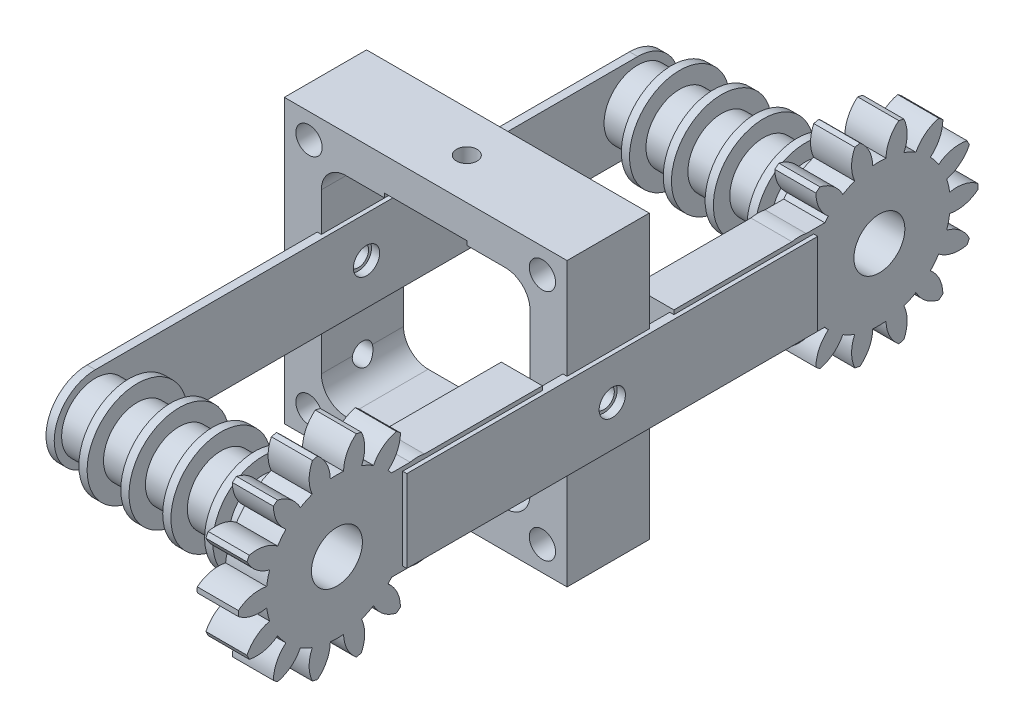
from build123d import *
from build123d.topology import SkipClean

# Parameters (mm, degrees)
BASPROSKE_W              = 5
BASPROSKE_H              = 12
TOOTHCUT_DEPTH           = 18.691806013
TEETHCUTS_COUNT          = 14
TEETHCUTS_ANGLE          = 334.285714286
BORSKE_R                 = 3.1
BORE_DEPTH               = 50.0000508
SKETCH_2_W               = 20
SKETCH_2_H               = 11
EXTRUDE_1_DEPTH          = 5
SKETCH_3_W               = 17
SKETCH_3_H               = 10
CUT_EXTRUDE_1_DEPTH      = 0.5
SKETCH_5_W               = 10
SKETCH_5_H               = 10
SKETCH_5_W_2             = 8
SKETCH_5_H_2             = 8
EXTRUDE_2_DEPTH          = 25
SKETCH_12_W              = 9
SKETCH_12_H              = 10
CUT_EXTRUDE_4_DEPTH      = 49.720495562
CUT_EXTRUDE_2_DEPTH      = 36.463878635
CUT_EXTRUDE_2_DEPTH_BACK = 36.463878635
SKETCH_4_R               = 1.25
SKETCH_7_R               = 4.1
SKETCH_7_R_2             = 3.1
EXTRUDE_3_DEPTH          = 4
PATTERN_LINEAR_1_COUNT   = 5
PATTERN_LINEAR_1_PITCH   = 5.1
SKETCH_14_R              = 3.1
EXTRUDE_5_DEPTH          = 1
SKETCH_15_W              = 34.4
SKETCH_15_H              = 34.4
SKETCH_15_R              = 1.6
EXTRUDE_6_DEPTH          = 5
SKETCH_17_R              = 6.1
SKETCH_17_R_2            = 3.1
EXTRUDE_8_DEPTH          = 1
PATTERN_LINEAR_3_COUNT   = 4
PATTERN_LINEAR_3_PITCH   = 5.1
PATTERN_LINEAR_2_COUNT   = 2
PATTERN_LINEAR_2_PITCH   = 100
MOVE_BODY_2_ANGLE        = 180
MOVE_BODY_2_2_ANGLE      = 180
MOVE_BODY_2_3_ANGLE      = 180
MOVE_BODY_2_4_ANGLE      = 180
MOVE_BODY_2_5_ANGLE      = 180
MOVE_BODY_2_6_ANGLE      = 180
MOVE_BODY_2_7_ANGLE      = 180
MOVE_BODY_2_8_ANGLE      = 180
MOVE_BODY_2_9_ANGLE      = 180
MOVE_BODY_2_10_ANGLE     = 180
MOVE_BODY_2_11_ANGLE     = 180
MOVE_BODY_2_12_ANGLE     = 180
MOVE_BODY_2_13_ANGLE     = 180
CUT_EXTRUDE_5_DEPTH      = 57.59196056
CUT_EXTRUDE_5_DEPTH_BACK = 57.59196056
SKETCH_16_W              = 10
SKETCH_16_H              = 1
SKETCH_16_W_2            = 1
SKETCH_16_H_2            = 10
EXTRUDE_START            = -5
EXTRUDE_7_OUTLINE_W      = 1
EXTRUDE_7_OUTLINE_H      = 10
EXTRUDE_7_DEPTH          = 5
EXTRUDE_7_2_OUTLINE_W    = 1
EXTRUDE_7_2_OUTLINE_H    = 10
EXTRUDE_7_2_DEPTH        = 5
EXTRUDE_7_3_OUTLINE_W    = 10
EXTRUDE_7_3_OUTLINE_H    = 1
EXTRUDE_7_3_DEPTH        = 5
EXTRUDE_7_4_OUTLINE_W    = 10
EXTRUDE_7_4_OUTLINE_H    = 1
EXTRUDE_7_4_DEPTH        = 5
SKETCH_21_R              = 1.25
CUT_EXTRUDE_6_DEPTH      = 88.265686269
SKETCH_22_R              = 1.25
CUT_EXTRUDE_7_DEPTH      = 91.367969989
SKETCH_23_R              = 1.6
CUT_EXTRUDE_8_DEPTH      = 88.265686269
SKETCH_24_R              = 1.6
CUT_EXTRUDE_9_DEPTH      = 91.367969989
SKETCH_26_R              = 1.25
CUT_EXTRUDE_10_DEPTH     = 10


with BuildPart() as part:
    # BasProSke → Base-Revolve (revolve)
    with BuildSketch(Plane(origin=(0, 0, 0), x_dir=(1, 0, 0), z_dir=(0, 1, 0)), mode=Mode.PRIVATE) as base_revolve_sk:
        with Locations((2.5, 6)):
            Rectangle(BASPROSKE_W, BASPROSKE_H)
    revolve(base_revolve_sk.sketch.rotate(Axis((-10, 0, 0), (1, 0, 0)), 180), axis=Axis((-10, 0, 0), (1, 0, 0)))

    # TooCutSke → ToothCut (cut, through all)
    with BuildSketch(Plane(origin=(0, 0, 0), x_dir=(0, 0, -1), z_dir=(1, 0, 0))):
        with BuildLine():
            ThreePointArc((0.804845511, 8.586361261), (0, 8.624), (-0.804845511, 8.586361261))
            ThreePointArc((-0.804845511, 8.586361261), (-1.237812142, 10.362618414), (-2.384428228, 11.78663426))
            ThreePointArc((-2.384428228, 11.78663426), (0, 12.0254), (2.384428228, 11.78663426))
            ThreePointArc((2.384428228, 11.78663426), (1.237812142, 10.362618414), (0.804845511, 8.586361261))
        make_face()
    toothcut = extrude(amount=TOOTHCUT_DEPTH, mode=Mode.SUBTRACT)

    # TeethCuts: ToothCut ×14 about axis
    teethcuts_axis = Axis((-10, 0, 0), (1, 0, 0))
    for i in range(1, TEETHCUTS_COUNT):
        add(toothcut.rotate(teethcuts_axis, i * TEETHCUTS_ANGLE / (TEETHCUTS_COUNT - 1)), mode=Mode.SUBTRACT)

    # BorSke → Bore (cut, symmetric)
    with BuildSketch(Plane(origin=(0, 0, 0), x_dir=(0, 0, -1), z_dir=(1, 0, 0))):
        with Locations(Location((0, 0, 0), (0, 0, 180))):
            Circle(BORSKE_R)
    extrude(amount=BORE_DEPTH, both=True, mode=Mode.SUBTRACT)

    # ｽｹｯﾁ2 → ﾎﾞｽ - 押し出し1 (add)
    with BuildSketch(Plane(origin=(5, 0, 0), x_dir=(0, 0, -1), z_dir=(1, 0, 0))):
        with Locations((15, 0)):
            Rectangle(SKETCH_2_W, SKETCH_2_H)
    extrude(amount=-EXTRUDE_1_DEPTH)

    # ｽｹｯﾁ3 → ｶｯﾄ - 押し出し1 (cut)
    with BuildSketch(Plane(origin=(5, 0, 0), x_dir=(0, 0, -1), z_dir=(1, 0, 0))):
        with Locations((16.5, 0)):
            Rectangle(SKETCH_3_W, SKETCH_3_H)
    extrude(amount=-CUT_EXTRUDE_1_DEPTH, mode=Mode.SUBTRACT)

    # ｽｹｯﾁ4 → ｶｯﾄ - 押し出し2 (cut, two sides: drawn at the far end of the back side and taken through both)
    with BuildSketch(Plane.ZY.offset(-CUT_EXTRUDE_2_DEPTH_BACK)):
        with Locations(Location((-21, 0, 0), (0, 0, 180))):
            Circle(SKETCH_4_R)
        with Locations(Location((-13, 0, 0), (0, 0, 180))):
            Circle(SKETCH_4_R)
    extrude(amount=CUT_EXTRUDE_2_DEPTH + CUT_EXTRUDE_2_DEPTH_BACK, mode=Mode.SUBTRACT)


with BuildPart() as body_2:
    # ｽｹｯﾁ5 → ﾎﾞｽ - 押し出し2 (new body)
    with BuildSketch(Plane(origin=(0, 0, -8), x_dir=(-1, 0, 0), z_dir=(0, 0, -1))):
        with Locations((-9.5, 0)):
            Rectangle(SKETCH_5_W, SKETCH_5_H)
        with Locations((-9.5, 0)):
            Rectangle(SKETCH_5_W_2, SKETCH_5_H_2, mode=Mode.SUBTRACT)
    extrude(amount=EXTRUDE_2_DEPTH)

    # ｽｹｯﾁ12 → ｶｯﾄ - 押し出し4 (cut, through all)
    with BuildSketch(Plane(origin=(0, 0, -33), x_dir=(-1, 0, 0), z_dir=(0, 0, -1))):
        with Locations((-10, 0)):
            Rectangle(SKETCH_12_W, SKETCH_12_H)
    extrude(amount=-CUT_EXTRUDE_4_DEPTH, mode=Mode.SUBTRACT)


with BuildPart() as body_3:
    # ｽｹｯﾁ7 → ﾎﾞｽ - 押し出し3 (new body)
    with BuildSketch(Plane.ZY):
        Circle(SKETCH_7_R)
        Circle(SKETCH_7_R_2, mode=Mode.SUBTRACT)
    extrude(amount=EXTRUDE_3_DEPTH)


with BuildPart() as pattern_linear_1_1:
    # 直線ﾊﾟﾀｰﾝ1: pattern copy
    add(body_3.part.moved(Location(Vector(-1, 0, 0) * (1 * PATTERN_LINEAR_1_PITCH))))


with BuildPart() as pattern_linear_1_2:
    # 直線ﾊﾟﾀｰﾝ1: pattern copy
    add(body_3.part.moved(Location(Vector(-1, 0, 0) * (2 * PATTERN_LINEAR_1_PITCH))))


with BuildPart() as pattern_linear_1_3:
    # 直線ﾊﾟﾀｰﾝ1: pattern copy
    add(body_3.part.moved(Location(Vector(-1, 0, 0) * (3 * PATTERN_LINEAR_1_PITCH))))


with BuildPart() as pattern_linear_1_4:
    # 直線ﾊﾟﾀｰﾝ1: pattern copy
    add(body_3.part.moved(Location(Vector(-1, 0, 0) * (4 * PATTERN_LINEAR_1_PITCH))))


with BuildPart() as body_8:
    # ｽｹｯﾁ14 → ﾎﾞｽ - 押し出し5 (new body)
    with BuildSketch(Plane.ZY.offset(24.4)):
        with BuildLine():
            Line((-33, 5), (0, 5))
            ThreePointArc((0, 5), (5, 0), (0, -5))
            Line((0, -5), (-33, -5))
            Line((-33, -5), (-33, 5))
        make_face()
        Circle(SKETCH_14_R, mode=Mode.SUBTRACT)
    extrude(amount=EXTRUDE_5_DEPTH)


with BuildPart() as body_9:
    # ｽｹｯﾁ15 → ﾎﾞｽ - 押し出し6 (new body)
    with BuildSketch(Plane(origin=(0, 0, -33), x_dir=(-1, 0, 0), z_dir=(0, 0, -1))):
        with Locations((12.2, 0)):
            Rectangle(SKETCH_15_W, SKETCH_15_H)
        with Locations(Location((26.4, 14.2, 0), (0, 0, 90))):
            Circle(SKETCH_15_R, mode=Mode.SUBTRACT)
        with Locations(Location((26.4, -14.2, 0), (0, 0, 90))):
            Circle(SKETCH_15_R, mode=Mode.SUBTRACT)
        with Locations(Location((-2, -14.2, 0), (0, 0, 90))):
            Circle(SKETCH_15_R, mode=Mode.SUBTRACT)
        with Locations(Location((-2, 14.2, 0), (0, 0, 90))):
            Circle(SKETCH_15_R, mode=Mode.SUBTRACT)
        with BuildLine():
            Line((21.9, -12.7), (2.5, -12.7))
            ThreePointArc((2.5, -12.7), (0.378679656, -11.821320344), (-0.5, -9.7))
            Line((-0.5, -9.7), (-0.5, 9.7))
            ThreePointArc((-0.5, 9.7), (0.378679656, 11.821320344), (2.5, 12.7))
            Line((2.5, 12.7), (21.9, 12.7))
            ThreePointArc((21.9, 12.7), (24.021320344, 11.821320344), (24.9, 9.7))
            Line((24.9, 9.7), (24.9, -9.7))
            ThreePointArc((24.9, -9.7), (24.021320344, -11.821320344), (21.9, -12.7))
        make_face(mode=Mode.SUBTRACT)
    extrude(amount=-EXTRUDE_6_DEPTH)


with BuildPart() as body_10:
    # ｽｹｯﾁ17 → ﾎﾞｽ - 押し出し8 (new body)
    with BuildSketch(Plane.ZY.offset(4)):
        Circle(SKETCH_17_R)
        Circle(SKETCH_17_R_2, mode=Mode.SUBTRACT)
    extrude(amount=EXTRUDE_8_DEPTH)


with BuildPart() as pattern_linear_3_1:
    # 直線ﾊﾟﾀｰﾝ3: pattern copy
    add(body_10.part.moved(Location(Vector(-1, 0, 0) * (1 * PATTERN_LINEAR_3_PITCH))))


with BuildPart() as pattern_linear_3_2:
    # 直線ﾊﾟﾀｰﾝ3: pattern copy
    add(body_10.part.moved(Location(Vector(-1, 0, 0) * (2 * PATTERN_LINEAR_3_PITCH))))


with BuildPart() as pattern_linear_3_3:
    # 直線ﾊﾟﾀｰﾝ3: pattern copy
    add(body_10.part.moved(Location(Vector(-1, 0, 0) * (3 * PATTERN_LINEAR_3_PITCH))))


with BuildPart() as pattern_linear_2_1:
    # 直線ﾊﾟﾀｰﾝ2: pattern copy
    add(body_10.part.moved(Location(Vector(0, 0, -1) * (1 * PATTERN_LINEAR_2_PITCH))))


with BuildPart() as pattern_linear_2_2:
    # 直線ﾊﾟﾀｰﾝ2: pattern copy
    add(pattern_linear_3_1.part.moved(Location(Vector(0, 0, -1) * (1 * PATTERN_LINEAR_2_PITCH))))


with BuildPart() as pattern_linear_2_3:
    # 直線ﾊﾟﾀｰﾝ2: pattern copy
    add(pattern_linear_3_2.part.moved(Location(Vector(0, 0, -1) * (1 * PATTERN_LINEAR_2_PITCH))))


with BuildPart() as pattern_linear_2_4:
    # 直線ﾊﾟﾀｰﾝ2: pattern copy
    add(pattern_linear_3_3.part.moved(Location(Vector(0, 0, -1) * (1 * PATTERN_LINEAR_2_PITCH))))


with BuildPart() as pattern_linear_2_5:
    # 直線ﾊﾟﾀｰﾝ2: pattern copy
    add(body_3.part.moved(Location(Vector(0, 0, -1) * (1 * PATTERN_LINEAR_2_PITCH))))


with BuildPart() as pattern_linear_2_6:
    # 直線ﾊﾟﾀｰﾝ2: pattern copy
    add(pattern_linear_1_1.part.moved(Location(Vector(0, 0, -1) * (1 * PATTERN_LINEAR_2_PITCH))))


with BuildPart() as pattern_linear_2_7:
    # 直線ﾊﾟﾀｰﾝ2: pattern copy
    add(body_9.part.moved(Location(Vector(0, 0, -1) * (1 * PATTERN_LINEAR_2_PITCH))))


with BuildPart() as pattern_linear_2_8:
    # 直線ﾊﾟﾀｰﾝ2: pattern copy
    add(pattern_linear_1_2.part.moved(Location(Vector(0, 0, -1) * (1 * PATTERN_LINEAR_2_PITCH))))


with BuildPart() as pattern_linear_2_9:
    # 直線ﾊﾟﾀｰﾝ2: pattern copy
    add(pattern_linear_1_3.part.moved(Location(Vector(0, 0, -1) * (1 * PATTERN_LINEAR_2_PITCH))))


with BuildPart() as pattern_linear_2_10:
    # 直線ﾊﾟﾀｰﾝ2: pattern copy
    add(body_2.part.moved(Location(Vector(0, 0, -1) * (1 * PATTERN_LINEAR_2_PITCH))))


with BuildPart() as pattern_linear_2_11:
    # 直線ﾊﾟﾀｰﾝ2: pattern copy
    add(part.part.moved(Location(Vector(0, 0, -1) * (1 * PATTERN_LINEAR_2_PITCH))))


with BuildPart() as pattern_linear_2_12:
    # 直線ﾊﾟﾀｰﾝ2: pattern copy
    add(pattern_linear_1_4.part.moved(Location(Vector(0, 0, -1) * (1 * PATTERN_LINEAR_2_PITCH))))


with BuildPart() as pattern_linear_2_13:
    # 直線ﾊﾟﾀｰﾝ2: pattern copy
    add(body_8.part.moved(Location(Vector(0, 0, -1) * (1 * PATTERN_LINEAR_2_PITCH))))


with BuildPart() as pattern_linear_2_2_1:
    # Move Body 2: read off the stored shape, not the designer's step
    # Move Body 2: moved
    add(pattern_linear_2_2.part.moved(Location((12.2, 12.2, 166))).rotate(Axis((0, 0, 0), (0.7071067812, -0.7071067812, 0)), MOVE_BODY_2_ANGLE))


with BuildPart() as pattern_linear_2_12_1:
    # Move Body 2 2: moved
    add(pattern_linear_2_12.part.moved(Location((12.2, 12.2, 166))).rotate(Axis((0, 0, 0), (0.7071067812, -0.7071067812, 0)), MOVE_BODY_2_2_ANGLE))


with BuildPart() as pattern_linear_2_9_1:
    # Move Body 2 3: moved
    add(pattern_linear_2_9.part.moved(Location((12.2, 12.2, 166))).rotate(Axis((0, 0, 0), (0.7071067812, -0.7071067812, 0)), MOVE_BODY_2_3_ANGLE))


with BuildPart() as pattern_linear_2_11_1:
    # Move Body 2 4: moved
    add(pattern_linear_2_11.part.moved(Location((12.2, 12.2, 166))).rotate(Axis((0, 0, 0), (0.7071067812, -0.7071067812, 0)), MOVE_BODY_2_4_ANGLE))


with BuildPart() as pattern_linear_2_3_1:
    # Move Body 2 5: moved
    add(pattern_linear_2_3.part.moved(Location((12.2, 12.2, 166))).rotate(Axis((0, 0, 0), (0.7071067812, -0.7071067812, 0)), MOVE_BODY_2_5_ANGLE))


with BuildPart() as pattern_linear_2_4_1:
    # Move Body 2 6: moved
    add(pattern_linear_2_4.part.moved(Location((12.2, 12.2, 166))).rotate(Axis((0, 0, 0), (0.7071067812, -0.7071067812, 0)), MOVE_BODY_2_6_ANGLE))


with BuildPart() as pattern_linear_2_5_1:
    # Move Body 2 7: moved
    add(pattern_linear_2_5.part.moved(Location((12.2, 12.2, 166))).rotate(Axis((0, 0, 0), (0.7071067812, -0.7071067812, 0)), MOVE_BODY_2_7_ANGLE))


with BuildPart() as pattern_linear_2_8_1:
    # Move Body 2 8: moved
    add(pattern_linear_2_8.part.moved(Location((12.2, 12.2, 166))).rotate(Axis((0, 0, 0), (0.7071067812, -0.7071067812, 0)), MOVE_BODY_2_8_ANGLE))


with BuildPart() as pattern_linear_2_6_1:
    # Move Body 2 9: moved
    add(pattern_linear_2_6.part.moved(Location((12.2, 12.2, 166))).rotate(Axis((0, 0, 0), (0.7071067812, -0.7071067812, 0)), MOVE_BODY_2_9_ANGLE))


with BuildPart() as pattern_linear_2_1_1:
    # Move Body 2 10: moved
    add(pattern_linear_2_1.part.moved(Location((12.2, 12.2, 166))).rotate(Axis((0, 0, 0), (0.7071067812, -0.7071067812, 0)), MOVE_BODY_2_10_ANGLE))


with BuildPart() as pattern_linear_2_13_1:
    # Move Body 2 11: moved
    add(pattern_linear_2_13.part.moved(Location((12.2, 12.2, 166))).rotate(Axis((0, 0, 0), (0.7071067812, -0.7071067812, 0)), MOVE_BODY_2_11_ANGLE))

    # Extrude 7 3 outline → Extrude 7 3 (add)
    with BuildSketch(Plane.XY.offset(-33)):
        with Locations((-12.2, 12.7)):
            Rectangle(EXTRUDE_7_3_OUTLINE_W, EXTRUDE_7_3_OUTLINE_H)
    extrude(amount=EXTRUDE_7_3_DEPTH)


with BuildPart() as pattern_linear_2_10_1:
    # Move Body 2 12: moved
    add(pattern_linear_2_10.part.moved(Location((12.2, 12.2, 166))).rotate(Axis((0, 0, 0), (0.7071067812, -0.7071067812, 0)), MOVE_BODY_2_12_ANGLE))

    # Extrude 7 4 outline → Extrude 7 4 (add)
    with BuildSketch(Plane.XY.offset(-33)):
        with Locations((-12.2, -17.2)):
            Rectangle(EXTRUDE_7_4_OUTLINE_W, EXTRUDE_7_4_OUTLINE_H)
    extrude(amount=EXTRUDE_7_4_DEPTH)


with BuildPart() as pattern_linear_2_7_1:
    # Move Body 2 13: moved
    add(pattern_linear_2_7.part.moved(Location((12.2, 12.2, 166))).rotate(Axis((0, 0, 0), (0.7071067812, -0.7071067812, 0)), MOVE_BODY_2_13_ANGLE))


with BuildPart() as cut_extrude_5_tool:
    # ｽｹｯﾁ16 → ｶｯﾄ - 押し出し5 (new, two sides: drawn at the far end of the back side and taken through both)
    with BuildSketch(Plane.XY.offset(-33).offset(-CUT_EXTRUDE_5_DEPTH_BACK)):
        with Locations((-12.2, -17.2)):
            Rectangle(SKETCH_16_W, SKETCH_16_H)
        with Locations((5, 0)):
            Rectangle(SKETCH_16_W_2, SKETCH_16_H_2)
        with Locations((-12.2, 12.7)):
            Rectangle(SKETCH_16_W, SKETCH_16_H)
        with Locations((-24.9, 0)):
            Rectangle(SKETCH_16_W_2, SKETCH_16_H_2)
    extrude(amount=CUT_EXTRUDE_5_DEPTH + CUT_EXTRUDE_5_DEPTH_BACK)


with BuildPart() as body_9_1:
    add(body_9.part)

    # ｶｯﾄ - 押し出し5: cut by cut_extrude_5_tool
    add(cut_extrude_5_tool.part, mode=Mode.SUBTRACT)


with BuildPart() as pattern_linear_2_7_2:
    add(pattern_linear_2_7_1.part)

    # ｶｯﾄ - 押し出し5: cut by cut_extrude_5_tool
    add(cut_extrude_5_tool.part, mode=Mode.SUBTRACT)


with BuildPart() as body_9_2:
    add(body_9_1.part)

    # Combine 1: union 直線ﾊﾟﾀｰﾝ2_7
    add(pattern_linear_2_7_2.part)

    # ｽｹｯﾁ21 → ｶｯﾄ - 押し出し6 (cut, through all)
    with SkipClean():  # the faces are left unmerged after this step: merging them gives an invalid solid
        with BuildSketch(Plane.ZY.offset(29.4)):
            with Locations((-33, 0)):
                Circle(SKETCH_21_R)
        extrude(amount=-CUT_EXTRUDE_6_DEPTH, mode=Mode.SUBTRACT)

    # ｽｹｯﾁ22 → ｶｯﾄ - 押し出し7 (cut, through all)
    with SkipClean():  # the faces are left unmerged after this step: merging them gives an invalid solid
        with BuildSketch(Plane.XZ.offset(17.7)):
            with Locations(Location((-12.2, -33, 0), (0, 0, 270))):
                Circle(SKETCH_22_R)
        extrude(amount=-CUT_EXTRUDE_7_DEPTH, mode=Mode.SUBTRACT)

    # ｽｹｯﾁ26 → ｶｯﾄ - 押し出し10 (cut)
    with SkipClean():  # the faces are left unmerged after this step: merging them gives an invalid solid
        with BuildSketch(Plane.ZY.offset(29.4)):
            with Locations((-33, 10)):
                Circle(SKETCH_26_R)
            with Locations(Location((-33, -10, 0), (0, 0, 13.886540362))):
                Circle(SKETCH_26_R)
        extrude(amount=-CUT_EXTRUDE_10_DEPTH, mode=Mode.SUBTRACT)


with BuildPart() as body_2_1:
    add(body_2.part)

    # ﾎﾞｽ - 押し出し7: read off the stored shape, not the designer's step
    # ﾎﾞｽ - 押し出し7 outline → ﾎﾞｽ - 押し出し7 (add)
    with BuildSketch(Plane.XY.offset(-33).offset(EXTRUDE_START)):
        with Locations((5, 0)):
            Rectangle(EXTRUDE_7_OUTLINE_W, EXTRUDE_7_OUTLINE_H)
    extrude(amount=EXTRUDE_7_DEPTH)


with BuildPart() as body_8_1:
    add(body_8.part)

    # Extrude 7 2 outline → Extrude 7 2 (add)
    with BuildSketch(Plane.XY.offset(-33).offset(EXTRUDE_START)):
        with Locations((-24.9, 0)):
            Rectangle(EXTRUDE_7_2_OUTLINE_W, EXTRUDE_7_2_OUTLINE_H)
    extrude(amount=EXTRUDE_7_2_DEPTH)


with BuildPart() as cut_extrude_8_tool:
    # ｽｹｯﾁ23 → ｶｯﾄ - 押し出し8 (new, through all)
    with BuildSketch(Plane.ZY.offset(29.4)):
        with Locations((-33, 0)):
            Circle(SKETCH_23_R)
    extrude(amount=-CUT_EXTRUDE_8_DEPTH)


with BuildPart() as body_2_2:
    add(body_2_1.part)

    # ｶｯﾄ - 押し出し8: cut by cut_extrude_8_tool
    add(cut_extrude_8_tool.part, mode=Mode.SUBTRACT)


with BuildPart() as body_8_2:
    add(body_8_1.part)

    # ｶｯﾄ - 押し出し8: cut by cut_extrude_8_tool
    add(cut_extrude_8_tool.part, mode=Mode.SUBTRACT)


with BuildPart() as cut_extrude_9_tool:
    # ｽｹｯﾁ24 → ｶｯﾄ - 押し出し9 (new, through all)
    with BuildSketch(Plane(origin=(0, 17.2, 0), x_dir=(1, 0, 0), z_dir=(0, 1, 0))):
        with Locations((-12.2, 33)):
            Circle(SKETCH_24_R)
    extrude(amount=-CUT_EXTRUDE_9_DEPTH)


with BuildPart() as pattern_linear_2_13_2:
    add(pattern_linear_2_13_1.part)

    # ｶｯﾄ - 押し出し9: cut by cut_extrude_9_tool
    add(cut_extrude_9_tool.part, mode=Mode.SUBTRACT)


with BuildPart() as pattern_linear_2_10_2:
    add(pattern_linear_2_10_1.part)

    # ｶｯﾄ - 押し出し9: cut by cut_extrude_9_tool
    add(cut_extrude_9_tool.part, mode=Mode.SUBTRACT)


with BuildPart() as body_14:
    # ﾐﾗｰ3: mirrored copy
    add(part.part.mirror(Plane(origin=(0, 0, -33), x_dir=(1, 0, 0), z_dir=(0, 0, -1))))


with BuildPart() as body_15:
    # Mirror 3 2: mirrored copy
    add(body_2_2.part.mirror(Plane(origin=(0, 0, -33), x_dir=(1, 0, 0), z_dir=(0, 0, -1))))


with BuildPart() as body_16:
    # Mirror 3 3: mirrored copy
    add(pattern_linear_1_1.part.mirror(Plane(origin=(0, 0, -33), x_dir=(1, 0, 0), z_dir=(0, 0, -1))))


with BuildPart() as body_17:
    # Mirror 3 4: mirrored copy
    add(pattern_linear_1_4.part.mirror(Plane(origin=(0, 0, -33), x_dir=(1, 0, 0), z_dir=(0, 0, -1))))


with BuildPart() as body_18:
    # Mirror 3 5: mirrored copy
    add(pattern_linear_3_1.part.mirror(Plane(origin=(0, 0, -33), x_dir=(1, 0, 0), z_dir=(0, 0, -1))))


with BuildPart() as body_19:
    # Mirror 3 6: mirrored copy
    add(body_3.part.mirror(Plane(origin=(0, 0, -33), x_dir=(1, 0, 0), z_dir=(0, 0, -1))))


with BuildPart() as body_20:
    # Mirror 3 7: mirrored copy
    add(pattern_linear_1_3.part.mirror(Plane(origin=(0, 0, -33), x_dir=(1, 0, 0), z_dir=(0, 0, -1))))


with BuildPart() as body_21:
    # Mirror 3 8: mirrored copy
    add(pattern_linear_3_3.part.mirror(Plane(origin=(0, 0, -33), x_dir=(1, 0, 0), z_dir=(0, 0, -1))))


with BuildPart() as body_22:
    # Mirror 3 9: mirrored copy
    add(pattern_linear_1_2.part.mirror(Plane(origin=(0, 0, -33), x_dir=(1, 0, 0), z_dir=(0, 0, -1))))


with BuildPart() as body_23:
    # Mirror 3 10: mirrored copy
    add(body_10.part.mirror(Plane(origin=(0, 0, -33), x_dir=(1, 0, 0), z_dir=(0, 0, -1))))


with BuildPart() as body_24:
    # Mirror 3 11: mirrored copy
    add(pattern_linear_3_2.part.mirror(Plane(origin=(0, 0, -33), x_dir=(1, 0, 0), z_dir=(0, 0, -1))))


with BuildPart() as body_25:
    # Mirror 3 12: mirrored copy
    add(body_8_2.part.mirror(Plane(origin=(0, 0, -33), x_dir=(1, 0, 0), z_dir=(0, 0, -1))))

    # Combine 2: union body 8
    add(body_8_2.part)


with BuildPart() as body_2_3:
    add(body_2_2.part)

    # Combine 3: union body 15
    add(body_15.part)


solid = Compound([part.part, body_3.part, pattern_linear_1_1.part, pattern_linear_1_2.part, pattern_linear_1_3.part, pattern_linear_1_4.part, body_10.part, pattern_linear_3_1.part, pattern_linear_3_2.part, pattern_linear_3_3.part, body_9_2.part, body_14.part, body_16.part, body_17.part, body_18.part, body_19.part, body_20.part, body_21.part, body_22.part, body_23.part, body_24.part, body_25.part, body_2_3.part])
